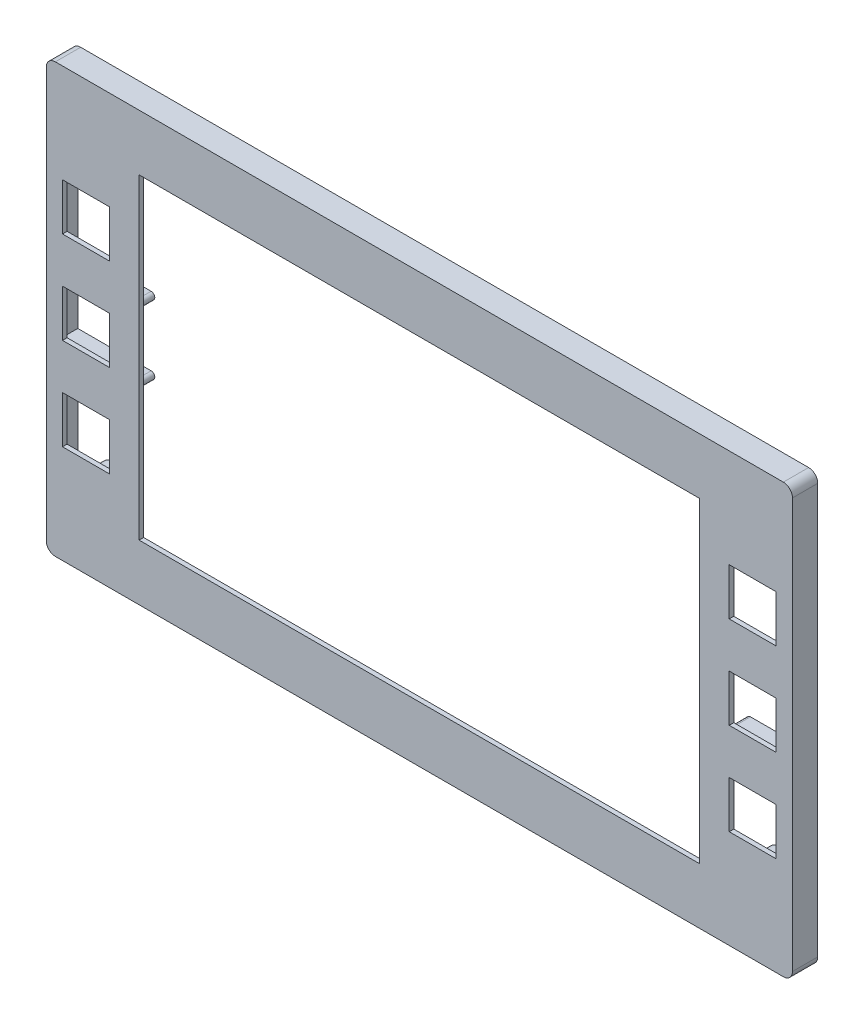
from build123d import *

# Parameters (mm, degrees)
SKETCH1_W           = 207.7922
SKETCH1_H           = 119.28
BOSS_EXTRUDE1_DEPTH = 5.7658
SKETCH2_W           = 207.7922
SKETCH2_H           = 119.28
SKETCH2_W_2         = 13.081
SKETCH2_H_2         = 13.081
SKETCH2_W_3         = 156.083
SKETCH2_H_3         = 88.0872
BOSS_EXTRUDE2_DEPTH = 1.27
FILLET1_R           = 2.54
SKETCH3_R           = 2.625
SKETCH3_R_2         = 1.125
BOSS_EXTRUDE3_DEPTH = 5.7658
FILLET2_R           = 2
CUT_EXTRUDE2_REACH  = 122.003
SKETCH4_W           = 10
SKETCH4_H           = 4


with BuildPart() as part:
    # Sketch1 → Boss-Extrude1 (new body)
    with BuildSketch(Plane.XY):
        Rectangle(SKETCH1_W, SKETCH1_H)
        with BuildLine():
            Line((83.7565, -54.2798), (83.7565, -57.89))
            Line((83.7565, -57.89), (102.1461, -57.89))
            Line((102.1461, -57.89), (102.1461, -10.6085))
            Line((102.1461, -10.6085), (85.1555, -10.6085))
            ThreePointArc((85.1555, -10.6085), (84.1375, -9.5905), (85.1555, -8.5725))
            Line((85.1555, -8.5725), (102.1461, -8.5725))
            Line((102.1461, -8.5725), (102.1461, 8.5725))
            Line((102.1461, 8.5725), (85.1555, 8.5725))
            ThreePointArc((85.1555, 8.5725), (84.1375, 9.5905), (85.1555, 10.6085))
            Line((85.1555, 10.6085), (102.1461, 10.6085))
            Line((102.1461, 10.6085), (102.1461, 57.89))
            Line((102.1461, 57.89), (83.7565, 57.89))
            Line((83.7565, 57.89), (83.7565, 49.7078))
            ThreePointArc((83.7565, 49.7078), (80.5815, 46.5328), (77.4065, 49.7078))
            Line((77.4065, 49.7078), (77.4065, 57.89))
            Line((77.4065, 57.89), (52.0065, 57.89))
            Line((52.0065, 57.89), (52.0065, 49.7078))
            ThreePointArc((52.0065, 49.7078), (48.8315, 46.5328), (45.6565, 49.7078))
            Line((45.6565, 49.7078), (45.6565, 57.89))
            Line((45.6565, 57.89), (-42.2275, 57.89))
            Line((-42.2275, 57.89), (-42.2275, 49.7078))
            ThreePointArc((-42.2275, 49.7078), (-45.4025, 46.5328), (-48.5775, 49.7078))
            Line((-48.5775, 49.7078), (-48.5775, 57.89))
            Line((-48.5775, 57.89), (-73.9775, 57.89))
            Line((-73.9775, 57.89), (-73.9775, 49.7078))
            ThreePointArc((-73.9775, 49.7078), (-77.1525, 46.5328), (-80.3275, 49.7078))
            Line((-80.3275, 49.7078), (-80.3275, 57.89))
            Line((-80.3275, 57.89), (-102.1461, 57.89))
            Line((-102.1461, 57.89), (-102.1461, 10.6085))
            Line((-102.1461, 10.6085), (-81.7265, 10.6085))
            ThreePointArc((-81.7265, 10.6085), (-80.7085, 9.5905), (-81.7265, 8.5725))
            Line((-81.7265, 8.5725), (-102.1461, 8.5725))
            Line((-102.1461, 8.5725), (-102.1461, -8.5725))
            Line((-102.1461, -8.5725), (-81.7265, -8.5725))
            ThreePointArc((-81.7265, -8.5725), (-80.7085, -9.5905), (-81.7265, -10.6085))
            Line((-81.7265, -10.6085), (-102.1461, -10.6085))
            Line((-102.1461, -10.6085), (-102.1461, -57.89))
            Line((-102.1461, -57.89), (-80.3275, -57.89))
            Line((-80.3275, -57.89), (-80.3275, -54.2798))
            ThreePointArc((-80.3275, -54.2798), (-77.1525, -51.1048), (-73.9775, -54.2798))
            Line((-73.9775, -54.2798), (-73.9775, -57.89))
            Line((-73.9775, -57.89), (-48.5775, -57.89))
            Line((-48.5775, -57.89), (-48.5775, -54.2798))
            ThreePointArc((-48.5775, -54.2798), (-45.4025, -51.1048), (-42.2275, -54.2798))
            Line((-42.2275, -54.2798), (-42.2275, -57.89))
            Line((-42.2275, -57.89), (45.6565, -57.89))
            Line((45.6565, -57.89), (45.6565, -54.2798))
            ThreePointArc((45.6565, -54.2798), (48.8315, -51.1048), (52.0065, -54.2798))
            Line((52.0065, -54.2798), (52.0065, -57.89))
            Line((52.0065, -57.89), (77.4065, -57.89))
            Line((77.4065, -57.89), (77.4065, -54.2798))
            ThreePointArc((77.4065, -54.2798), (80.5815, -51.1048), (83.7565, -54.2798))
        make_face(mode=Mode.SUBTRACT)
    extrude(amount=BOSS_EXTRUDE1_DEPTH)

    # Sketch2 → Boss-Extrude2 (add)
    with BuildSketch(Plane.XY.offset(5.7658)):
        Rectangle(SKETCH2_W, SKETCH2_H)
        with Locations((92.8243, 25.66)):
            Rectangle(SKETCH2_W_2, SKETCH2_H_2, mode=Mode.SUBTRACT)
        with Locations((92.8243, 0)):
            Rectangle(SKETCH2_W_2, SKETCH2_H_2, mode=Mode.SUBTRACT)
        with Locations((92.8243, -25.66)):
            Rectangle(SKETCH2_W_2, SKETCH2_H_2, mode=Mode.SUBTRACT)
        with Locations((-92.8243, -25.66)):
            Rectangle(SKETCH2_W_2, SKETCH2_H_2, mode=Mode.SUBTRACT)
        Rectangle(SKETCH2_W_3, SKETCH2_H_3, mode=Mode.SUBTRACT)
        with Locations((-92.8243, 0)):
            Rectangle(SKETCH2_W_2, SKETCH2_H_2, mode=Mode.SUBTRACT)
        with Locations((-92.8243, 25.66)):
            Rectangle(SKETCH2_W_2, SKETCH2_H_2, mode=Mode.SUBTRACT)
    extrude(amount=BOSS_EXTRUDE2_DEPTH)

    # Fillet1
    fillet1_edges = [part.edges().sort_by_distance(p)[0] for p in [
        (-103.8961, 59.64, 3.5179),
        (103.8961, 59.64, 3.5179),
        (103.8961, -59.64, 3.5179),
        (-103.8961, -59.64, 3.5179),
    ]]
    fillet(fillet1_edges, radius=FILLET1_R)

    # Sketch3 → Boss-Extrude3 (add)
    # profile 1 of 6: a face of its own
    with BuildSketch(Plane(origin=(0, 0, 5.7658), x_dir=(-1, 0, 0), z_dir=(0, 0, -1))):
        with Locations(Location((-92.825, 38.5525, 0), (0, 0, 180))):
            Circle(SKETCH3_R)
        with Locations(Location((-92.825, 38.5525, 0), (0, 0, 180))):
            Circle(SKETCH3_R_2, mode=Mode.SUBTRACT)
    # profile 2 of 6: a face of its own
    with BuildSketch(Plane(origin=(0, 0, 5.7658), x_dir=(-1, 0, 0), z_dir=(0, 0, -1))):
        with Locations(Location((92.825, 38.5525, 0), (0, 0, 180))):
            Circle(SKETCH3_R)
        with Locations(Location((92.825, 38.5525, 0), (0, 0, 180))):
            Circle(SKETCH3_R_2, mode=Mode.SUBTRACT)
    # profile 3 of 6: a face of its own
    with BuildSketch(Plane(origin=(0, 0, 5.7658), x_dir=(-1, 0, 0), z_dir=(0, 0, -1))):
        with Locations(Location((-92.825, -38.5525, 0), (0, 0, 180))):
            Circle(SKETCH3_R)
        with Locations(Location((-92.825, -38.5525, 0), (0, 0, 180))):
            Circle(SKETCH3_R_2, mode=Mode.SUBTRACT)
    # profile 4 of 6: a face of its own
    with BuildSketch(Plane(origin=(0, 0, 5.7658), x_dir=(-1, 0, 0), z_dir=(0, 0, -1))):
        with Locations(Location((92.825, -38.5525, 0), (0, 0, 180))):
            Circle(SKETCH3_R)
        with Locations(Location((92.825, -38.5525, 0), (0, 0, 180))):
            Circle(SKETCH3_R_2, mode=Mode.SUBTRACT)
    # profile 5 of 6: a face of its own
    with BuildSketch(Plane(origin=(0, 0, 5.7658), x_dir=(-1, 0, 0), z_dir=(0, 0, -1))):
        with Locations(Location((0, 53.4525, 0), (0, 0, 180))):
            Circle(SKETCH3_R)
        with Locations(Location((0, 53.4525, 0), (0, 0, 180))):
            Circle(SKETCH3_R_2, mode=Mode.SUBTRACT)
    # profile 6 of 6: a face of its own
    with BuildSketch(Plane(origin=(0, 0, 5.7658), x_dir=(-1, 0, 0), z_dir=(0, 0, -1))):
        with Locations(Location((0, -53.4525, 0), (0, 0, 180))):
            Circle(SKETCH3_R)
        with Locations(Location((0, -53.4525, 0), (0, 0, 180))):
            Circle(SKETCH3_R_2, mode=Mode.SUBTRACT)
    extrude(amount=BOSS_EXTRUDE3_DEPTH)

    # Fillet2
    # the kernel refuses this fillet: 2 mm, written as the material it adds along each edge
    with BuildSketch(Plane(origin=(92.825, 38.5525, 5.7658), x_dir=(1, 0, 0), z_dir=(0, 1, 0))) as fillet2_piece_1:
        with BuildLine():
            CenterArc((2.625 + FILLET2_R, FILLET2_R), FILLET2_R, 180, 90)
            Line((2.625, FILLET2_R), (2.625, 0))
            Line((2.625, 0), (2.625 + FILLET2_R, 0))
        make_face()
    revolve(axis=Axis((92.825, 38.5525, 5.7658), (0, 0, -1)))
    with BuildSketch(Plane(origin=(0, 53.4525, 5.7658), x_dir=(1, 0, 0), z_dir=(0, 1, 0))) as fillet2_piece_2:
        with BuildLine():
            CenterArc((2.625 + FILLET2_R, FILLET2_R), FILLET2_R, 180, 90)
            Line((2.625, FILLET2_R), (2.625, 0))
            Line((2.625, 0), (2.625 + FILLET2_R, 0))
        make_face()
    revolve(axis=Axis((0, 53.4525, 5.7658), (0, 0, -1)))
    with BuildSketch(Plane(origin=(-92.825, -38.5525, 5.7658), x_dir=(1, 0, 0), z_dir=(0, 1, 0))) as fillet2_piece_3:
        with BuildLine():
            CenterArc((2.625 + FILLET2_R, FILLET2_R), FILLET2_R, 180, 90)
            Line((2.625, FILLET2_R), (2.625, 0))
            Line((2.625, 0), (2.625 + FILLET2_R, 0))
        make_face()
    revolve(axis=Axis((-92.825, -38.5525, 5.7658), (0, 0, -1)))
    with BuildSketch(Plane(origin=(92.825, -38.5525, 5.7658), x_dir=(1, 0, 0), z_dir=(0, 1, 0))) as fillet2_piece_4:
        with BuildLine():
            CenterArc((2.625 + FILLET2_R, FILLET2_R), FILLET2_R, 180, 90)
            Line((2.625, FILLET2_R), (2.625, 0))
            Line((2.625, 0), (2.625 + FILLET2_R, 0))
        make_face()
    revolve(axis=Axis((92.825, -38.5525, 5.7658), (0, 0, -1)))
    with BuildSketch(Plane(origin=(-92.825, 38.5525, 5.7658), x_dir=(1, 0, 0), z_dir=(0, 1, 0))) as fillet2_piece_5:
        with BuildLine():
            CenterArc((2.625 + FILLET2_R, FILLET2_R), FILLET2_R, 180, 90)
            Line((2.625, FILLET2_R), (2.625, 0))
            Line((2.625, 0), (2.625 + FILLET2_R, 0))
        make_face()
    revolve(axis=Axis((-92.825, 38.5525, 5.7658), (0, 0, -1)))
    with BuildSketch(Plane(origin=(0, -53.4525, 5.7658), x_dir=(1, 0, 0), z_dir=(0, 1, 0))) as fillet2_piece_6:
        with BuildLine():
            CenterArc((2.625 + FILLET2_R, FILLET2_R), FILLET2_R, 180, 90)
            Line((2.625, FILLET2_R), (2.625, 0))
            Line((2.625, 0), (2.625 + FILLET2_R, 0))
        make_face()
    revolve(axis=Axis((0, -53.4525, 5.7658), (0, 0, -1)))

    # Cut-Extrude2: up to this face of the body (flat: up to its plane)
    cut_extrude2_end = Plane(part.part.faces().sort_by_distance((54.354697423, -56.0849, 5.7658))[0])
    # Sketch4 → Cut-Extrude2 (cut, up to the picked face)
    with BuildSketch(Plane(origin=(0, 0, 0), x_dir=(-1, 0, 0), z_dir=(0, 0, -1)), mode=Mode.PRIVATE) as cut_extrude2_sk1:
        with Locations((0, -49.1275)):
            Rectangle(SKETCH4_W, SKETCH4_H)
    cut_extrude2_tool1 = split(extrude(cut_extrude2_sk1.sketch, amount=-CUT_EXTRUDE2_REACH, mode=Mode.PRIVATE), bisect_by=cut_extrude2_end, keep=Keep.BOTH, mode=Mode.PRIVATE)
    add(cut_extrude2_tool1.solids().sort_by(Axis((0, -49.1275, 0), (0, 0, 1)))[0], mode=Mode.SUBTRACT)


solid = part.part
